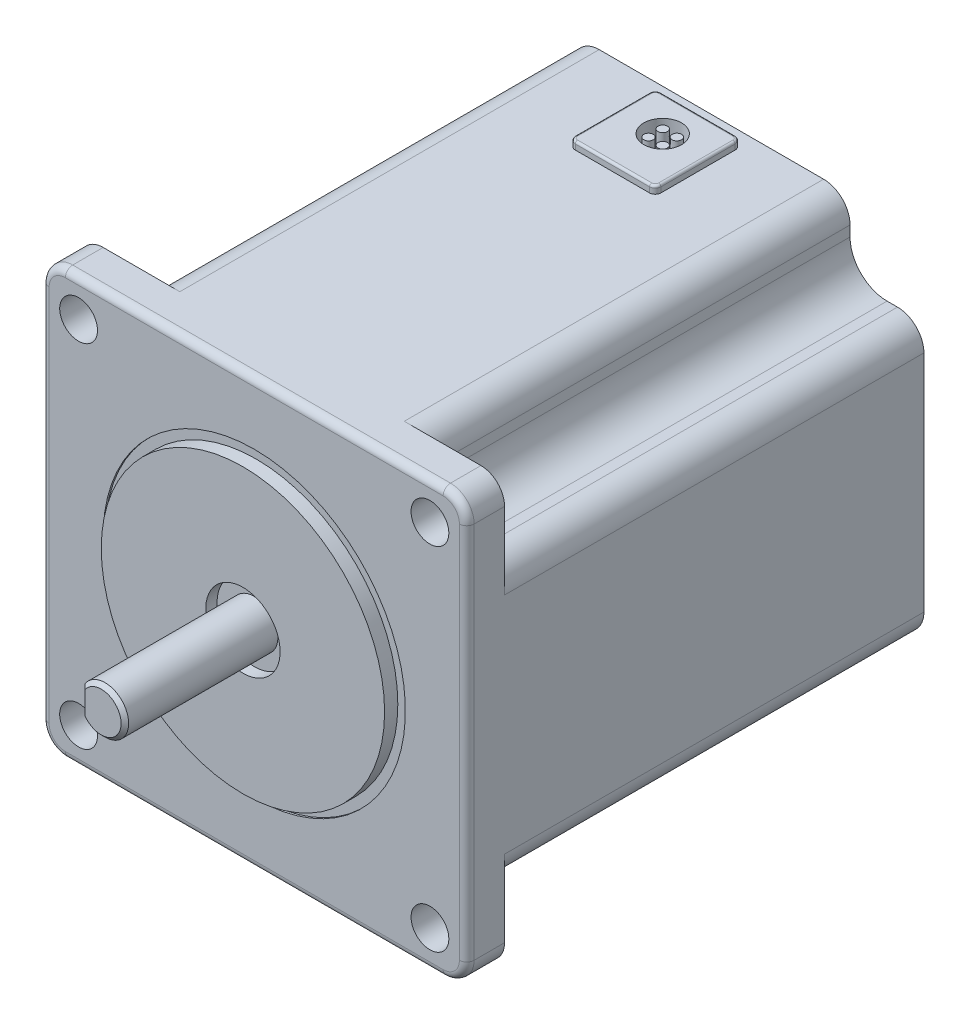
from build123d import *

# Parameters (mm, degrees)
BOSS_EXTRUDE1_DEPTH = 5.08
FILLET1_R           = 0.9906
BOSS_EXTRUDE2_DEPTH = 56.388
SKETCH5_W           = 1.524
SKETCH5_H           = 19.05
SKETCH6_W           = 0.254
SKETCH6_H           = 1.27
SKETCH7_W           = 76.962
SKETCH7_H           = 3.175
CUT_EXTRUDE1_START  = -14.986
CUT_EXTRUDE1_DEPTH  = 14.986
CHAMFER1_SIZE       = 0.508
SKETCH9_R           = 2.54
CUT_EXTRUDE2_DEPTH  = 5.08
CUT_EXTRUDE3_DEPTH  = 1.2954
SKETCH11_R          = 3.7465
SKETCH11_R_2        = 2.54
BOSS_EXTRUDE3_DEPTH = 1.2954
SKETCH12_W          = 11.5062
SKETCH12_H          = 11.5062
SKETCH12_R          = 2.54
BOSS_EXTRUDE4_DEPTH = 1.016
FILLET2_R           = 0.762
FILLET3_R           = 0.3048
SKETCH13_R          = 0.635
BOSS_EXTRUDE5_DEPTH = 1.9304


with BuildPart() as part:
    # Sketch3 → Boss-Extrude1 (new body)
    with BuildSketch(Plane.XY):
        with BuildLine():
            Line((-28.575, -25.4), (-28.575, 25.4))
            ThreePointArc((-28.575, 25.4), (-27.64506403, 27.64506403), (-25.4, 28.575))
            Line((-25.4, 28.575), (25.4, 28.575))
            ThreePointArc((25.4, 28.575), (27.64506403, 27.64506403), (28.575, 25.4))
            Line((28.575, 25.4), (28.575, -25.4))
            ThreePointArc((28.575, -25.4), (27.64506403, -27.64506403), (25.4, -28.575))
            Line((25.4, -28.575), (-25.4, -28.575))
            ThreePointArc((-25.4, -28.575), (-27.64506403, -27.64506403), (-28.575, -25.4))
        make_face()
    extrude(amount=-BOSS_EXTRUDE1_DEPTH)

    # Fillet1
    fillet1_edges = [part.edges().sort_by_distance(p)[0] for p in [
        (-28.575, 0, 0),
        (-27.64506403, 27.64506403, 0),
        (0, 28.575, 0),
        (27.64506403, 27.64506403, 0),
        (28.575, 0, 0),
        (27.64506403, -27.64506403, 0),
        (0, -28.575, 0),
        (-27.64506403, -27.64506403, 0),
    ]]
    fillet(fillet1_edges, radius=FILLET1_R)

    # Sketch4 → Boss-Extrude2 (add)
    with BuildSketch(Plane.XY.offset(-5.08)):
        with BuildLine():
            Line((-25.019, 18.6436), (-23.622, 18.6436))
            ThreePointArc((-23.622, 18.6436), (-20.101739601, 20.101739601), (-18.6436, 23.622))
            Line((-18.6436, 23.622), (-18.6436, 25.019))
            ThreePointArc((-18.6436, 25.019), (-17.602071714, 27.533471714), (-15.0876, 28.575))
            Line((-15.0876, 28.575), (15.0876, 28.575))
            ThreePointArc((15.0876, 28.575), (17.602071714, 27.533471714), (18.6436, 25.019))
            Line((18.6436, 25.019), (18.6436, 23.622))
            ThreePointArc((18.6436, 23.622), (20.101739601, 20.101739601), (23.622, 18.6436))
            Line((23.622, 18.6436), (25.019, 18.6436))
            ThreePointArc((25.019, 18.6436), (27.533471714, 17.602071714), (28.575, 15.0876))
            Line((28.575, 15.0876), (28.575, -15.0876))
            ThreePointArc((28.575, -15.0876), (27.533471714, -17.602071714), (25.019, -18.6436))
            Line((25.019, -18.6436), (23.622, -18.6436))
            ThreePointArc((23.622, -18.6436), (20.101739601, -20.101739601), (18.6436, -23.622))
            Line((18.6436, -23.622), (18.6436, -25.019))
            ThreePointArc((18.6436, -25.019), (17.602071714, -27.533471714), (15.0876, -28.575))
            Line((15.0876, -28.575), (-15.0876, -28.575))
            ThreePointArc((-15.0876, -28.575), (-17.602071714, -27.533471714), (-18.6436, -25.019))
            Line((-18.6436, -25.019), (-18.6436, -23.622))
            ThreePointArc((-18.6436, -23.622), (-20.101739601, -20.101739601), (-23.622, -18.6436))
            Line((-23.622, -18.6436), (-25.019, -18.6436))
            ThreePointArc((-25.019, -18.6436), (-27.533471714, -17.602071714), (-28.575, -15.0876))
            Line((-28.575, -15.0876), (-28.575, 15.0876))
            ThreePointArc((-28.575, 15.0876), (-27.533471714, 17.602071714), (-25.019, 18.6436))
        make_face()
    extrude(amount=-BOSS_EXTRUDE2_DEPTH)

    # Sketch5 → Revolve1 (revolve)
    with BuildSketch(Plane(origin=(0, 0, 0), x_dir=(0, 0, -1), z_dir=(1, 0, 0))):
        with Locations((-0.762, 9.525)):
            Rectangle(SKETCH5_W, SKETCH5_H)
    revolve(axis=Axis((0, 0, 0), (0, 0, 1)))

    # Sketch6 → Cut-Revolve1 (revolve, cut)
    with BuildSketch(Plane(origin=(0, 0, 0), x_dir=(0, 0, -1), z_dir=(1, 0, 0)), mode=Mode.PRIVATE) as cut_revolve1_sk:
        Polygon((56.388, 0), (-1.524, 0), (-1.524, 4.99999), (0, 4.99999), (0, 3.175), (56.388, 3.175), align=None)
        with Locations((0.127, 19.685)):
            Rectangle(SKETCH6_W, SKETCH6_H)
    revolve(cut_revolve1_sk.sketch.rotate(Axis((0, 0, 20.574), (0, 0, -1)), 180), axis=Axis((0, 0, 20.574), (0, 0, -1)), mode=Mode.SUBTRACT)

    # Sketch9 → Cut-Extrude2 (cut)
    with BuildSketch(Plane.XY):
        with Locations((23.622, -23.622)):
            Circle(SKETCH9_R)
        with Locations((-23.622, -23.622)):
            Circle(SKETCH9_R)
        with Locations((-23.622, 23.622)):
            Circle(SKETCH9_R)
        with Locations((23.622, 23.622)):
            Circle(SKETCH9_R)
    extrude(amount=-CUT_EXTRUDE2_DEPTH, mode=Mode.SUBTRACT)

    # Sketch10 → Cut-Extrude3 (cut)
    with BuildSketch(Plane(origin=(0, 28.575, -0.751200197), x_dir=(1, 0, 0), z_dir=(0, 1, 0))):
        with BuildLine():
            Line((-3.8354, 54.168679803), (-3.8354, 49.215679803))
            Line((-3.8354, 49.215679803), (3.8354, 49.215679803))
            Line((3.8354, 49.215679803), (3.8354, 54.168679803))
            ThreePointArc((3.8354, 54.168679803), (0, 58.004079803), (-3.8354, 54.168679803))
        make_face()
    extrude(amount=-CUT_EXTRUDE3_DEPTH, mode=Mode.SUBTRACT)

    # Sketch11 → Boss-Extrude3 (add)
    with BuildSketch(Plane(origin=(0, 27.2796, 0), x_dir=(1, 0, 0), z_dir=(0, 1, 0))):
        with Locations(Location((0, 54.91988, 0), (0, 0, 270))):
            Circle(SKETCH11_R)
        with Locations(Location((0, 54.91988, 0), (0, 0, 270))):
            Circle(SKETCH11_R_2, mode=Mode.SUBTRACT)
    extrude(amount=BOSS_EXTRUDE3_DEPTH)

    # Sketch12 → Boss-Extrude4 (add)
    with BuildSketch(Plane(origin=(0, 28.575, 0), x_dir=(1, 0, 0), z_dir=(0, 1, 0))):
        with Locations((0, 53.91658)):
            Rectangle(SKETCH12_W, SKETCH12_H)
        with Locations(Location((0, 54.91988, 0), (0, 0, 270))):
            Circle(SKETCH12_R, mode=Mode.SUBTRACT)
    extrude(amount=BOSS_EXTRUDE4_DEPTH)

    # Fillet2
    fillet2_edges = [part.edges().sort_by_distance(p)[0] for p in [
        (5.7531, 29.083, -48.16348),
        (5.7531, 29.083, -59.66968),
        (-5.7531, 29.083, -59.66968),
        (-5.7531, 29.083, -48.16348),
    ]]
    fillet(fillet2_edges, radius=FILLET2_R)

    # Fillet3
    fillet3_edges = [part.edges().sort_by_distance(p)[0] for p in [
        (0, 29.591, -59.66968),
        (5.7531, 29.591, -53.91658),
        (-5.7531, 29.591, -53.91658),
        (0, 29.591, -48.16348),
        (-5.529915367, 29.591, -48.386664633),
        (5.529915367, 29.591, -48.386664633),
        (-5.529915367, 29.591, -59.446495367),
        (5.529915367, 29.591, -59.446495367),
    ]]
    fillet(fillet3_edges, radius=FILLET3_R)

    # Sketch13 → Boss-Extrude5 (add)
    with BuildSketch(Plane(origin=(0, 27.2796, 0), x_dir=(1, 0, 0), z_dir=(0, 1, 0))):
        with Locations(Location((-0.9525, 55.87238, 0), (0, 0, 270))):
            Circle(SKETCH13_R)
        with Locations(Location((0.9525, 55.87238, 0), (0, 0, 270))):
            Circle(SKETCH13_R)
        with Locations(Location((0.9525, 53.96738, 0), (0, 0, 270))):
            Circle(SKETCH13_R)
        with Locations(Location((-0.9525, 53.96738, 0), (0, 0, 270))):
            Circle(SKETCH13_R)
    extrude(amount=BOSS_EXTRUDE5_DEPTH)


with BuildPart() as body_2:
    # Sketch7 → Revolve2 (revolve)
    with BuildSketch(Plane(origin=(0, 0, 0), x_dir=(0, 0, -1), z_dir=(1, 0, 0)), mode=Mode.PRIVATE) as revolve2_sk:
        with Locations((17.907, 1.5875)):
            Rectangle(SKETCH7_W, SKETCH7_H)
    revolve(revolve2_sk.sketch.rotate(Axis((0, 0, 20.574), (0, 0, -1)), 180), axis=Axis((0, 0, 20.574), (0, 0, -1)))

    # Sketch8 → Cut-Extrude1 (cut)
    with BuildSketch(Plane.XY.offset(20.574).offset(CUT_EXTRUDE1_START)):
        with BuildLine():
            Line((-2.667, -1.722711816), (-2.667, 1.722711816))
            ThreePointArc((-2.667, 1.722711816), (-3.175, 0), (-2.667, -1.722711816))
        make_face()
    extrude(amount=CUT_EXTRUDE1_DEPTH, mode=Mode.SUBTRACT)

    # Chamfer1
    chamfer1_edges = [body_2.edges().sort_by_distance(p)[0] for p in [
        (-2.667, 0, 20.574),
        (0, 3.175, -56.388),
        (2.78838977, 1.51838977, 20.574),
    ]]
    chamfer(chamfer1_edges, length=CHAMFER1_SIZE - 0.0001)  # a hair under: the kernel refuses the full size


solid = Compound([part.part, body_2.part])
